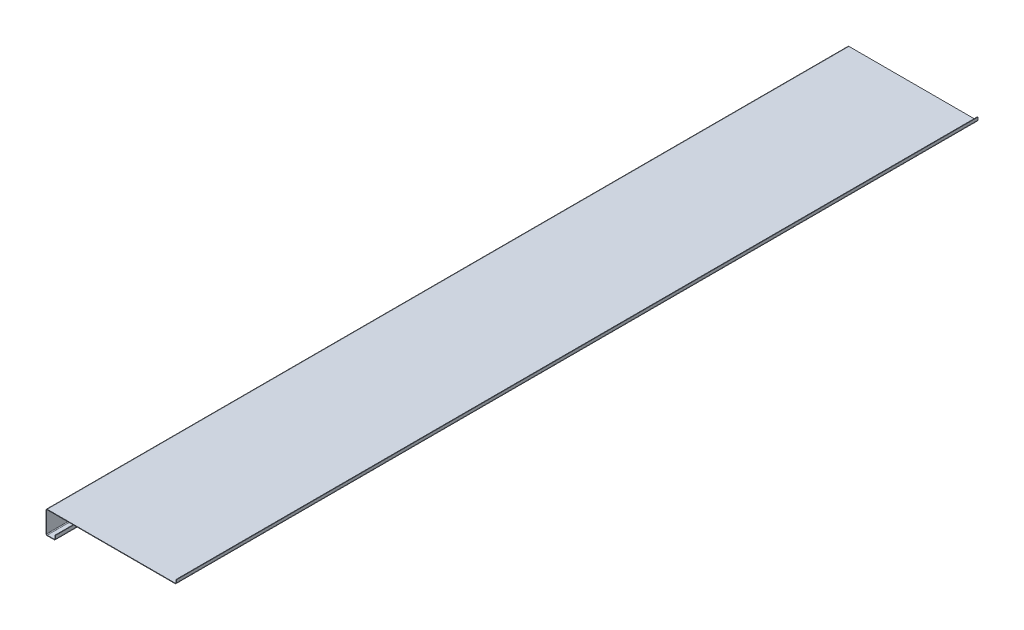
from build123d import *

# Parameters (mm, degrees)
BASE_FLANGE1_DEPTH = 2080


# Sheet-metal steps are written as plain solids
with BuildPart() as part:
    # Sketch1 → Base-Flange1 (new body)
    with BuildSketch(Plane.XY):
        with BuildLine():
            Line((0, 10), (0, 3.25))
            ThreePointArc((0, 3.25), (-0.951902961, 0.951902961), (-3.25, 0))
            Line((-3.25, 0), (-334.75, 0))
            ThreePointArc((-334.75, 0), (-336.164213562, -0.585786438), (-336.75, -2))
            Line((-336.75, -2), (-336.75, -55))
            ThreePointArc((-336.75, -55), (-336.164213562, -56.414213562), (-334.75, -57))
            Line((-334.75, -57), (-316.75, -57))
            ThreePointArc((-316.75, -57), (-315.335786438, -56.414213562), (-314.75, -55))
            Line((-314.75, -55), (-314.75, -47))
            Line((-314.75, -47), (-313.5, -47))
            Line((-313.5, -47), (-313.5, -55))
            ThreePointArc((-313.5, -55), (-314.451902961, -57.298097039), (-316.75, -58.25))
            Line((-316.75, -58.25), (-334.75, -58.25))
            ThreePointArc((-334.75, -58.25), (-337.048097039, -57.298097039), (-338, -55))
            Line((-338, -55), (-338, -2))
            ThreePointArc((-338, -2), (-337.048097039, 0.298097039), (-334.75, 1.25))
            Line((-334.75, 1.25), (-3.25, 1.25))
            ThreePointArc((-3.25, 1.25), (-1.835786438, 1.835786438), (-1.25, 3.25))
            Line((-1.25, 3.25), (-1.25, 10))
            Line((-1.25, 10), (0, 10))
        make_face()
    extrude(amount=BASE_FLANGE1_DEPTH)


solid = part.part
